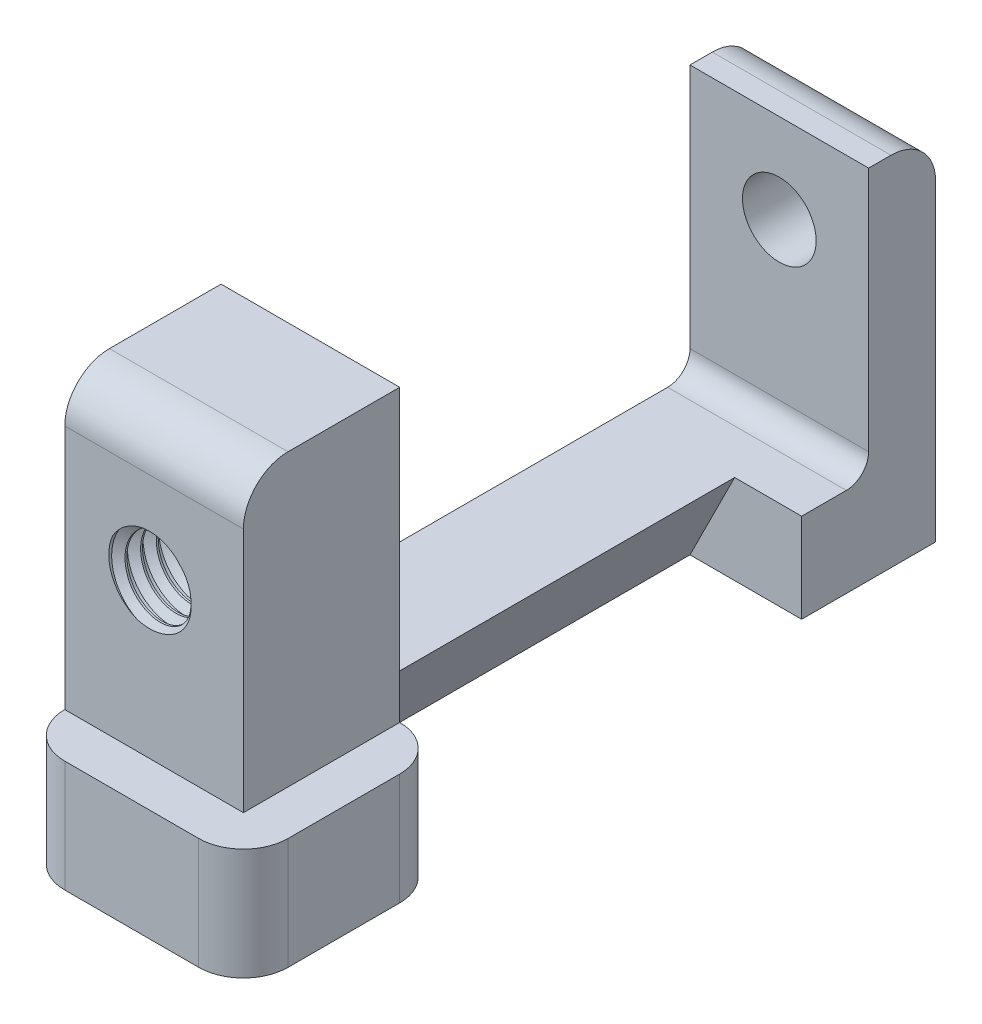
from build123d import *

# Parameters (mm, degrees)
BOSS_EXTRUDE1_DEPTH             = 8
CUT_EXTRUDE2_DEPTH              = 21
SKETCH6_W                       = 35.270415117
SKETCH6_H                       = 22.226622545
CUT_EXTRUDE3_DEPTH              = 8
BOSS_EXTRUDE2_DEPTH             = 3
BOSS_EXTRUDE7_DEPTH             = 5
SKETCH7_R                       = 1.65
CUT_EXTRUDE6_DEPTH              = 40.255572853
FILLET1_R                       = 2
THREAD1_PITCH                   = 0.7
THREAD2_PITCH                   = 0.5
FILLET2_R                       = 1
TAP_DRILL_FOR_M3X0_5_TAP2_D     = 2.5
TAP_DRILL_FOR_M3X0_5_TAP2_DEPTH = 3
TAP_DRILL_FOR_M3X0_5_TAP2_TIP   = 0.751075774
THREAD4_PITCH                   = 0.5


# Read off the part's stored shape, not the designer's step: Tap Drill for M3x0.5 Tap
with BuildPart() as part:
    # Sketch1 → Boss-Extrude1 (new body)
    with BuildSketch(Plane(origin=(0, 0, 0), x_dir=(0, 0, -1), z_dir=(1, 0, 0))):
        Polygon((0, 0), (0, 16), (-3, 16), (-3, 4), (-24, 4), (-24, 18), (-31, 18), (-31, 0), align=None)
    boss_extrude1 = extrude(amount=-BOSS_EXTRUDE1_DEPTH)

    # Sketch5 → Cut-Extrude2 (cut)
    with BuildSketch(Plane.XY.offset(3)):
        Polygon((-8, 0), (-3, 0), (-5, 4), (-8, 4), align=None)
    cut_extrude2 = extrude(amount=CUT_EXTRUDE2_DEPTH, mode=Mode.SUBTRACT)

    # Mirror1: Boss-Extrude1, Cut-Extrude2 across plane
    add(boss_extrude1.mirror(Plane(origin=(-8, 0, 0), x_dir=(0, 0, 1), z_dir=(1, 0, 0))))
    add(cut_extrude2.mirror(Plane(origin=(-8, 0, 0), x_dir=(0, 0, 1), z_dir=(1, 0, 0))), mode=Mode.SUBTRACT)

    # Sketch6 → Cut-Extrude3 (cut)
    with BuildSketch(Plane(origin=(0, 0, 0), x_dir=(0, 0, -1), z_dir=(1, 0, 0))):
        with Locations((-16.260875851, 8.713036563)):
            Rectangle(SKETCH6_W, SKETCH6_H)
    extrude(amount=-CUT_EXTRUDE3_DEPTH, mode=Mode.SUBTRACT)

    # Sketch9 → Boss-Extrude2 (add)
    with BuildSketch(Plane.XY.offset(3)):
        Polygon((-11, 4), (-13, 0), (-8, 0), (-8, 4), align=None)
    extrude(amount=BOSS_EXTRUDE2_DEPTH)

    # Sketch13 → Boss-Extrude7 (add)
    with BuildSketch(Plane.XZ):
        with BuildLine():
            Line((-14, 33), (-6, 33))
            Line((-6, 33), (-6, 26))
            ThreePointArc((-6, 26), (-6.585786438, 24.585786438), (-8, 24))
            Line((-8, 24), (-8, 31))
            Line((-8, 31), (-16, 31))
            ThreePointArc((-16, 31), (-15.414213562, 32.414213562), (-14, 33))
        make_face()
    extrude(amount=-BOSS_EXTRUDE7_DEPTH)

    # Sketch7 → Cut-Extrude6 (cut, through all)
    with BuildSketch(Plane.XY.offset(31)):
        with Locations((-12, 12)):
            Circle(SKETCH7_R)
    extrude(amount=-CUT_EXTRUDE6_DEPTH, mode=Mode.SUBTRACT)

    # Fillet1
    fillet1_edges = [part.edges().sort_by_distance(p)[0] for p in [
        (-6, 2.5, 33),
        (-12, 18, 31),
        (-12, 16, 0),
    ]]
    fillet(fillet1_edges, radius=FILLET1_R)

    # Tap Drill for M3x0.5 Tap outline → Tap Drill for M3x0.5 Tap (revolve, cut)
    with BuildSketch(Plane(origin=(-11.9, 0, 3), x_dir=(1, 0, 0), z_dir=(0, 0, 1))):
        Polygon((1.25, 3), (0, 3.751075774), (0, 0), (1.25, 0), align=None)
    revolve(axis=Axis((-11.9, 0, 3), (0, 1, 0)), mode=Mode.SUBTRACT)

    # Thread1: the profile of Thread Profile2 profile screwed along a right-hand helix of 10 turns, 6 arcs to a turn; built about Z, then put on its axis
    thread1_z = Axis((0, 0, 0), (0, 0, 1))
    thread1_corners = [(1.6497, 0, 0.612673207), (1.6497, 0, -0.000173205), (2.028886116, 0, 0.218750001), (2.028886116, 0, 0.393750001)]
    with BuildLine(mode=Mode.PRIVATE) as thread1_profile:
        Line(thread1_corners[0], thread1_corners[1])
        Line(thread1_corners[1], thread1_corners[2])
        Line(thread1_corners[2], thread1_corners[3])
        Line(thread1_corners[3], thread1_corners[0])
    thread1_cap = Face(thread1_profile.wire())
    thread1_turn_angles = [0, 30, 60, 90, 120, 150, 180, 210, 240, 270, 300, 330, 360]
    thread1_turn_weights = [1, 0.8660254037844387, 1, 0.8660254037844387, 1, 0.8660254037844387, 1, 0.8660254037844387, 1, 0.8660254037844387, 1, 0.8660254037844387, 1]
    thread1_turn_rails = [Edge.make_bspline([Vector(p[0], p[1], 0).rotate(thread1_z, thread1_turn_angles[k]) / thread1_turn_weights[k] + Vector(0, 0, p[2] + THREAD1_PITCH * thread1_turn_angles[k] / 360) for k in range(13)], [0, 0, 0, 1, 1, 2, 2, 3, 3, 4, 4, 5, 5, 6, 6, 6], 2, thread1_turn_weights) for p in thread1_corners]
    thread1_turn_sides = [Face.make_surface_from_curves(thread1_turn_rails[p[0]], thread1_turn_rails[p[1]]) for p in [(0, 1), (1, 2), (2, 3), (3, 0)]]
    thread1 = Plane(origin=(-12, 12, 24), x_dir=(1, 0, 0), z_dir=(0, 0, 1)) * Solid(Shell([*[p.moved(Location((0, 0, THREAD1_PITCH * i))) for i in range(10) for p in thread1_turn_sides], thread1_cap, thread1_cap.rotate(thread1_z, 3600).moved(Location((0, 0, THREAD1_PITCH * 3600 / 360)))]))
    add(thread1, mode=Mode.SUBTRACT)

    # Thread2: the profile of Thread Profile3 profile screwed along a right-hand helix of 6 turns, 6 arcs to a turn; built about Z, then put on its axis
    thread2_z = Axis((0, 0, 0), (0, 0, 1))
    thread2_corners = [(1.2497, 0, -0.000173205), (1.520632937, 0, 0.156249999), (1.520632937, 0, 0.218749999), (1.2497, 0, 0.375173204)]
    with BuildLine(mode=Mode.PRIVATE) as thread2_profile:
        Line(thread2_corners[0], thread2_corners[1])
        Line(thread2_corners[1], thread2_corners[2])
        Line(thread2_corners[2], thread2_corners[3])
        Line(thread2_corners[3], thread2_corners[0])
    thread2_cap = Face(thread2_profile.wire())
    thread2_turn_angles = [0, 30, 60, 90, 120, 150, 180, 210, 240, 270, 300, 330, 360]
    thread2_turn_weights = [1, 0.8660254037844387, 1, 0.8660254037844387, 1, 0.8660254037844387, 1, 0.8660254037844387, 1, 0.8660254037844387, 1, 0.8660254037844387, 1]
    thread2_turn_rails = [Edge.make_bspline([Vector(p[0], p[1], 0).rotate(thread2_z, thread2_turn_angles[k]) / thread2_turn_weights[k] + Vector(0, 0, p[2] + THREAD2_PITCH * thread2_turn_angles[k] / 360) for k in range(13)], [0, 0, 0, 1, 1, 2, 2, 3, 3, 4, 4, 5, 5, 6, 6, 6], 2, thread2_turn_weights) for p in thread2_corners]
    thread2_turn_sides = [Face.make_surface_from_curves(thread2_turn_rails[p[0]], thread2_turn_rails[p[1]]) for p in [(0, 1), (1, 2), (2, 3), (3, 0)]]
    thread2 = Plane(origin=(-11.9, 0, 3), x_dir=(1, 0, 0), z_dir=(0, 1, 0)) * Solid(Shell([*[p.moved(Location((0, 0, THREAD2_PITCH * i))) for i in range(6) for p in thread2_turn_sides], thread2_cap, thread2_cap.rotate(thread2_z, 2160).moved(Location((0, 0, THREAD2_PITCH * 2160 / 360)))]))
    add(thread2, mode=Mode.SUBTRACT)

    # Fillet2
    fillet2_edges = [part.edges().sort_by_distance(p)[0] for p in [
        (-13.5, 4, 24),
        (-12, 4, 3),
    ]]
    fillet(fillet2_edges, radius=FILLET2_R)

    # Tap Drill for M3x0.5 Tap2
    with Locations(Plane(origin=(-10.28, 0, 29), x_dir=(0, 0, -1), z_dir=(0, -1, 0))):
        with Locations((0, 0)):
            Hole(TAP_DRILL_FOR_M3X0_5_TAP2_D / 2, depth=TAP_DRILL_FOR_M3X0_5_TAP2_DEPTH)
            with Locations((0, 0, -(TAP_DRILL_FOR_M3X0_5_TAP2_DEPTH + TAP_DRILL_FOR_M3X0_5_TAP2_TIP / 2))):  # 118° drill point
                Cone(0, TAP_DRILL_FOR_M3X0_5_TAP2_D / 2, TAP_DRILL_FOR_M3X0_5_TAP2_TIP, mode=Mode.SUBTRACT)

    # Thread4: the profile of Thread Profile5 profile screwed along a right-hand helix of 6 turns, 6 arcs to a turn; built about Z, then put on its axis
    thread4_z = Axis((0, 0, 0), (0, 0, 1))
    thread4_corners = [(1.2497, 0, -0.000173205), (1.520632937, 0, 0.156249999), (1.520632937, 0, 0.218749999), (1.2497, 0, 0.375173204)]
    with BuildLine(mode=Mode.PRIVATE) as thread4_profile:
        Line(thread4_corners[0], thread4_corners[1])
        Line(thread4_corners[1], thread4_corners[2])
        Line(thread4_corners[2], thread4_corners[3])
        Line(thread4_corners[3], thread4_corners[0])
    thread4_cap = Face(thread4_profile.wire())
    thread4_turn_angles = [0, 30, 60, 90, 120, 150, 180, 210, 240, 270, 300, 330, 360]
    thread4_turn_weights = [1, 0.8660254037844387, 1, 0.8660254037844387, 1, 0.8660254037844387, 1, 0.8660254037844387, 1, 0.8660254037844387, 1, 0.8660254037844387, 1]
    thread4_turn_rails = [Edge.make_bspline([Vector(p[0], p[1], 0).rotate(thread4_z, thread4_turn_angles[k]) / thread4_turn_weights[k] + Vector(0, 0, p[2] + THREAD4_PITCH * thread4_turn_angles[k] / 360) for k in range(13)], [0, 0, 0, 1, 1, 2, 2, 3, 3, 4, 4, 5, 5, 6, 6, 6], 2, thread4_turn_weights) for p in thread4_corners]
    thread4_turn_sides = [Face.make_surface_from_curves(thread4_turn_rails[p[0]], thread4_turn_rails[p[1]]) for p in [(0, 1), (1, 2), (2, 3), (3, 0)]]
    thread4 = Plane(origin=(-10.28, 0, 29), x_dir=(1, 0, 0), z_dir=(0, 1, 0)) * Solid(Shell([*[p.moved(Location((0, 0, THREAD4_PITCH * i))) for i in range(6) for p in thread4_turn_sides], thread4_cap, thread4_cap.rotate(thread4_z, 2160).moved(Location((0, 0, THREAD4_PITCH * 2160 / 360)))]))
    add(thread4, mode=Mode.SUBTRACT)


solid = part.part
